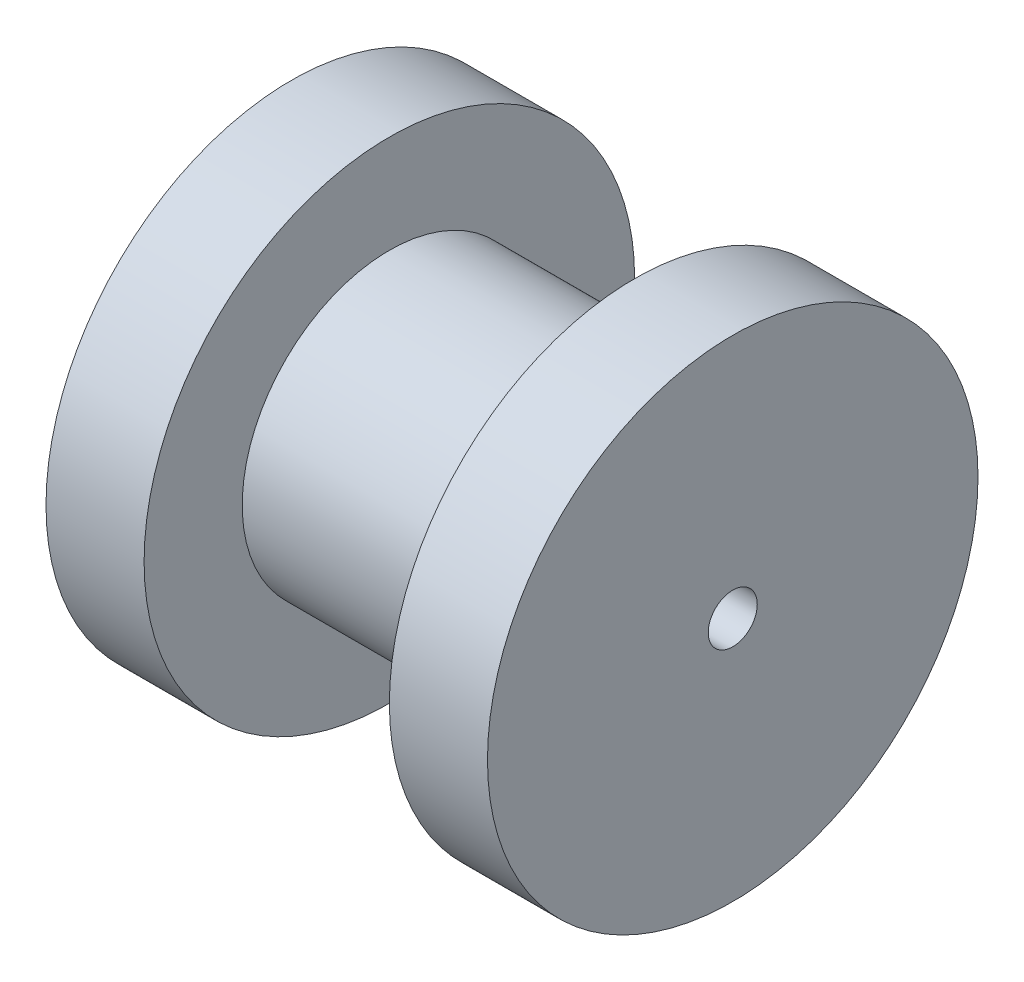
from build123d import *

# Parameters (mm, degrees)
SKETCH1_R           = 5
BOSS_EXTRUDE1_DEPTH = 2
SKETCH2_R           = 3
BOSS_EXTRUDE2_DEPTH = 5
SKETCH5_R           = 5
BOSS_EXTRUDE4_DEPTH = 2
CUT_EXTRUDE1_DEPTH  = 1
SKETCH7_R           = 0.5
CUT_EXTRUDE2_DEPTH  = 12.445523142


with BuildPart() as part:
    # Sketch1 → Boss-Extrude1 (new body)
    with BuildSketch(Plane(origin=(0, 0, 0), x_dir=(0, 0, -1), z_dir=(1, 0, 0))):
        Circle(SKETCH1_R)
    extrude(amount=BOSS_EXTRUDE1_DEPTH)

    # Sketch2 → Boss-Extrude2 (add)
    with BuildSketch(Plane(origin=(2, 0, 0), x_dir=(0, 0, -1), z_dir=(1, 0, 0))):
        Circle(SKETCH2_R)
    extrude(amount=BOSS_EXTRUDE2_DEPTH)

    # Sketch5 → Boss-Extrude4 (add)
    with BuildSketch(Plane(origin=(7, 0, 0), x_dir=(0, 0, -1), z_dir=(1, 0, 0))):
        Circle(SKETCH5_R)
    extrude(amount=BOSS_EXTRUDE4_DEPTH)

    # Sketch6 → Cut-Extrude1 (cut)
    with BuildSketch(Plane.ZY):
        with BuildLine():
            Line((0.095962652, 2.197906087), (0.109048468, 2.497620554))
            ThreePointArc((0.109048468, 2.497620554), (0.217889357, 2.490486745), (0.326315481, 2.478612153))
            Line((0.326315481, 2.478612153), (0.287157623, 2.181178695))
            ThreePointArc((0.287157623, 2.181178695), (0.382025991, 2.166577057), (0.476167151, 2.147851216))
            Line((0.476167151, 2.147851216), (0.541099035, 2.440740018))
            ThreePointArc((0.541099035, 2.440740018), (0.647047613, 2.414814566), (0.751764499, 2.384292377))
            Line((0.751764499, 2.384292377), (0.661552759, 2.098177292))
            ThreePointArc((0.661552759, 2.098177292), (0.752444315, 2.067323766), (0.841903551, 2.032534972))
            Line((0.841903551, 2.032534972), (0.956708581, 2.309698831))
            ThreePointArc((0.956708581, 2.309698831), (1.056545654, 2.265769468), (1.154371533, 2.217527083))
            Line((1.154371533, 2.217527083), (1.015846949, 1.951423833))
            ThreePointArc((1.015846949, 1.951423833), (1.1, 1.905255888), (1.182059138, 1.855461181))
            Line((1.182059138, 1.855461181), (1.343249021, 2.108478615))
            ThreePointArc((1.343249021, 2.108478615), (1.433941091, 2.047880111), (1.521903573, 1.983383351))
            Line((1.521903573, 1.983383351), (1.339275144, 1.745377349))
            ThreePointArc((1.339275144, 1.745377349), (1.414132741, 1.685297775), (1.486298457, 1.622010141))
            Line((1.486298457, 1.622010141), (1.688975519, 1.843193342))
            ThreePointArc((1.688975519, 1.843193342), (1.767766953, 1.767766953), (1.843193342, 1.688975519))
            Line((1.843193342, 1.688975519), (1.622010141, 1.486298457))
            ThreePointArc((1.622010141, 1.486298457), (1.685297775, 1.414132741), (1.745377349, 1.339275144))
            Line((1.745377349, 1.339275144), (1.983383351, 1.521903573))
            ThreePointArc((1.983383351, 1.521903573), (2.047880111, 1.433941091), (2.108478615, 1.343249021))
            Line((2.108478615, 1.343249021), (1.855461181, 1.182059138))
            ThreePointArc((1.855461181, 1.182059138), (1.905255888, 1.1), (1.951423833, 1.015846949))
            Line((1.951423833, 1.015846949), (2.217527083, 1.154371533))
            ThreePointArc((2.217527083, 1.154371533), (2.265769468, 1.056545654), (2.309698831, 0.956708581))
            Line((2.309698831, 0.956708581), (2.032534972, 0.841903551))
            ThreePointArc((2.032534972, 0.841903551), (2.067323766, 0.752444315), (2.098177292, 0.661552759))
            Line((2.098177292, 0.661552759), (2.384292377, 0.751764499))
            ThreePointArc((2.384292377, 0.751764499), (2.414814566, 0.647047613), (2.440740018, 0.541099035))
            Line((2.440740018, 0.541099035), (2.147851216, 0.476167151))
            ThreePointArc((2.147851216, 0.476167151), (2.166577057, 0.382025991), (2.181178695, 0.287157623))
            Line((2.181178695, 0.287157623), (2.478612153, 0.326315481))
            ThreePointArc((2.478612153, 0.326315481), (2.490486745, 0.217889357), (2.497620554, 0.109048468))
            Line((2.497620554, 0.109048468), (2.197906087, 0.095962652))
            ThreePointArc((2.197906087, 0.095962652), (2.2, 0), (2.197906087, -0.095962652))
            Line((2.197906087, -0.095962652), (2.497620554, -0.109048468))
            ThreePointArc((2.497620554, -0.109048468), (2.490486745, -0.217889357), (2.478612153, -0.326315481))
            Line((2.478612153, -0.326315481), (2.181178695, -0.287157623))
            ThreePointArc((2.181178695, -0.287157623), (2.166577057, -0.382025991), (2.147851216, -0.476167151))
            Line((2.147851216, -0.476167151), (2.440740018, -0.541099035))
            ThreePointArc((2.440740018, -0.541099035), (2.414814566, -0.647047613), (2.384292377, -0.751764499))
            Line((2.384292377, -0.751764499), (2.098177292, -0.661552759))
            ThreePointArc((2.098177292, -0.661552759), (2.067323766, -0.752444315), (2.032534972, -0.841903551))
            Line((2.032534972, -0.841903551), (2.309698831, -0.956708581))
            ThreePointArc((2.309698831, -0.956708581), (2.265769468, -1.056545654), (2.217527083, -1.154371533))
            Line((2.217527083, -1.154371533), (1.951423833, -1.015846949))
            ThreePointArc((1.951423833, -1.015846949), (1.905255888, -1.1), (1.855461181, -1.182059138))
            Line((1.855461181, -1.182059138), (2.108478615, -1.343249021))
            ThreePointArc((2.108478615, -1.343249021), (2.047880111, -1.433941091), (1.983383351, -1.521903573))
            Line((1.983383351, -1.521903573), (1.745377349, -1.339275144))
            ThreePointArc((1.745377349, -1.339275144), (1.685297775, -1.414132741), (1.622010141, -1.486298457))
            Line((1.622010141, -1.486298457), (1.843193342, -1.688975519))
            ThreePointArc((1.843193342, -1.688975519), (1.767766953, -1.767766953), (1.688975519, -1.843193342))
            Line((1.688975519, -1.843193342), (1.486298457, -1.622010141))
            ThreePointArc((1.486298457, -1.622010141), (1.414132741, -1.685297775), (1.339275144, -1.745377349))
            Line((1.339275144, -1.745377349), (1.521903573, -1.983383351))
            ThreePointArc((1.521903573, -1.983383351), (1.433941091, -2.047880111), (1.343249021, -2.108478615))
            Line((1.343249021, -2.108478615), (1.182059138, -1.855461181))
            ThreePointArc((1.182059138, -1.855461181), (1.1, -1.905255888), (1.015846949, -1.951423833))
            Line((1.015846949, -1.951423833), (1.154371533, -2.217527083))
            ThreePointArc((1.154371533, -2.217527083), (1.056545654, -2.265769468), (0.956708581, -2.309698831))
            Line((0.956708581, -2.309698831), (0.841903551, -2.032534972))
            ThreePointArc((0.841903551, -2.032534972), (0.752444315, -2.067323766), (0.661552759, -2.098177292))
            Line((0.661552759, -2.098177292), (0.751764499, -2.384292377))
            ThreePointArc((0.751764499, -2.384292377), (0.647047613, -2.414814566), (0.541099035, -2.440740018))
            Line((0.541099035, -2.440740018), (0.476167151, -2.147851216))
            ThreePointArc((0.476167151, -2.147851216), (0.382025991, -2.166577057), (0.287157623, -2.181178695))
            Line((0.287157623, -2.181178695), (0.326315481, -2.478612153))
            ThreePointArc((0.326315481, -2.478612153), (0.217889357, -2.490486745), (0.109048468, -2.497620554))
            Line((0.109048468, -2.497620554), (0.095962652, -2.197906087))
            ThreePointArc((0.095962652, -2.197906087), (0, -2.2), (-0.095962652, -2.197906087))
            Line((-0.095962652, -2.197906087), (-0.109048468, -2.497620554))
            ThreePointArc((-0.109048468, -2.497620554), (-0.217889357, -2.490486745), (-0.326315481, -2.478612153))
            Line((-0.326315481, -2.478612153), (-0.287157623, -2.181178695))
            ThreePointArc((-0.287157623, -2.181178695), (-0.382025991, -2.166577057), (-0.476167151, -2.147851216))
            Line((-0.476167151, -2.147851216), (-0.541099035, -2.440740018))
            ThreePointArc((-0.541099035, -2.440740018), (-0.647047613, -2.414814566), (-0.751764499, -2.384292377))
            Line((-0.751764499, -2.384292377), (-0.661552759, -2.098177292))
            ThreePointArc((-0.661552759, -2.098177292), (-0.752444315, -2.067323766), (-0.841903551, -2.032534972))
            Line((-0.841903551, -2.032534972), (-0.956708581, -2.309698831))
            ThreePointArc((-0.956708581, -2.309698831), (-1.056545654, -2.265769468), (-1.154371533, -2.217527083))
            Line((-1.154371533, -2.217527083), (-1.015846949, -1.951423833))
            ThreePointArc((-1.015846949, -1.951423833), (-1.1, -1.905255888), (-1.182059138, -1.855461181))
            Line((-1.182059138, -1.855461181), (-1.343249021, -2.108478615))
            ThreePointArc((-1.343249021, -2.108478615), (-1.433941091, -2.047880111), (-1.521903573, -1.983383351))
            Line((-1.521903573, -1.983383351), (-1.339275144, -1.745377349))
            ThreePointArc((-1.339275144, -1.745377349), (-1.414132741, -1.685297775), (-1.486298457, -1.622010141))
            Line((-1.486298457, -1.622010141), (-1.688975519, -1.843193342))
            ThreePointArc((-1.688975519, -1.843193342), (-1.767766953, -1.767766953), (-1.843193342, -1.688975519))
            Line((-1.843193342, -1.688975519), (-1.622010141, -1.486298457))
            ThreePointArc((-1.622010141, -1.486298457), (-1.685297775, -1.414132741), (-1.745377349, -1.339275144))
            Line((-1.745377349, -1.339275144), (-1.983383351, -1.521903573))
            ThreePointArc((-1.983383351, -1.521903573), (-2.047880111, -1.433941091), (-2.108478615, -1.343249021))
            Line((-2.108478615, -1.343249021), (-1.855461181, -1.182059138))
            ThreePointArc((-1.855461181, -1.182059138), (-1.905255888, -1.1), (-1.951423833, -1.015846949))
            Line((-1.951423833, -1.015846949), (-2.217527083, -1.154371533))
            ThreePointArc((-2.217527083, -1.154371533), (-2.265769468, -1.056545654), (-2.309698831, -0.956708581))
            Line((-2.309698831, -0.956708581), (-2.032534972, -0.841903551))
            ThreePointArc((-2.032534972, -0.841903551), (-2.067323766, -0.752444315), (-2.098177292, -0.661552759))
            Line((-2.098177292, -0.661552759), (-2.384292377, -0.751764499))
            ThreePointArc((-2.384292377, -0.751764499), (-2.414814566, -0.647047613), (-2.440740018, -0.541099035))
            Line((-2.440740018, -0.541099035), (-2.147851216, -0.476167151))
            ThreePointArc((-2.147851216, -0.476167151), (-2.166577057, -0.382025991), (-2.181178695, -0.287157623))
            Line((-2.181178695, -0.287157623), (-2.478612153, -0.326315481))
            ThreePointArc((-2.478612153, -0.326315481), (-2.490486745, -0.217889357), (-2.497620554, -0.109048468))
            Line((-2.497620554, -0.109048468), (-2.197906087, -0.095962652))
            ThreePointArc((-2.197906087, -0.095962652), (-2.2, 0), (-2.197906087, 0.095962652))
            Line((-2.197906087, 0.095962652), (-2.497620554, 0.109048468))
            ThreePointArc((-2.497620554, 0.109048468), (-2.490486745, 0.217889357), (-2.478612153, 0.326315481))
            Line((-2.478612153, 0.326315481), (-2.181178695, 0.287157623))
            ThreePointArc((-2.181178695, 0.287157623), (-2.166577057, 0.382025991), (-2.147851216, 0.476167151))
            Line((-2.147851216, 0.476167151), (-2.440740018, 0.541099035))
            ThreePointArc((-2.440740018, 0.541099035), (-2.414814566, 0.647047613), (-2.384292377, 0.751764499))
            Line((-2.384292377, 0.751764499), (-2.098177292, 0.661552759))
            ThreePointArc((-2.098177292, 0.661552759), (-2.067323766, 0.752444315), (-2.032534972, 0.841903551))
            Line((-2.032534972, 0.841903551), (-2.309698831, 0.956708581))
            ThreePointArc((-2.309698831, 0.956708581), (-2.265769468, 1.056545654), (-2.217527083, 1.154371533))
            Line((-2.217527083, 1.154371533), (-1.951423833, 1.015846949))
            ThreePointArc((-1.951423833, 1.015846949), (-1.905255888, 1.1), (-1.855461181, 1.182059138))
            Line((-1.855461181, 1.182059138), (-2.108478615, 1.343249021))
            ThreePointArc((-2.108478615, 1.343249021), (-2.047880111, 1.433941091), (-1.983383351, 1.521903573))
            Line((-1.983383351, 1.521903573), (-1.745377349, 1.339275144))
            ThreePointArc((-1.745377349, 1.339275144), (-1.685297775, 1.414132741), (-1.622010141, 1.486298457))
            Line((-1.622010141, 1.486298457), (-1.843193342, 1.688975519))
            ThreePointArc((-1.843193342, 1.688975519), (-1.767766953, 1.767766953), (-1.688975519, 1.843193342))
            Line((-1.688975519, 1.843193342), (-1.486298457, 1.622010141))
            ThreePointArc((-1.486298457, 1.622010141), (-1.414132741, 1.685297775), (-1.339275144, 1.745377349))
            Line((-1.339275144, 1.745377349), (-1.521903573, 1.983383351))
            ThreePointArc((-1.521903573, 1.983383351), (-1.433941091, 2.047880111), (-1.343249021, 2.108478615))
            Line((-1.343249021, 2.108478615), (-1.182059138, 1.855461181))
            ThreePointArc((-1.182059138, 1.855461181), (-1.1, 1.905255888), (-1.015846949, 1.951423833))
            Line((-1.015846949, 1.951423833), (-1.154371533, 2.217527083))
            ThreePointArc((-1.154371533, 2.217527083), (-1.056545654, 2.265769468), (-0.956708581, 2.309698831))
            Line((-0.956708581, 2.309698831), (-0.841903551, 2.032534972))
            ThreePointArc((-0.841903551, 2.032534972), (-0.752444315, 2.067323766), (-0.661552759, 2.098177292))
            Line((-0.661552759, 2.098177292), (-0.751764499, 2.384292377))
            ThreePointArc((-0.751764499, 2.384292377), (-0.647047613, 2.414814566), (-0.541099035, 2.440740018))
            Line((-0.541099035, 2.440740018), (-0.476167151, 2.147851216))
            ThreePointArc((-0.476167151, 2.147851216), (-0.382025991, 2.166577057), (-0.287157623, 2.181178695))
            Line((-0.287157623, 2.181178695), (-0.326315481, 2.478612153))
            ThreePointArc((-0.326315481, 2.478612153), (-0.217889357, 2.490486745), (-0.109048468, 2.497620554))
            Line((-0.109048468, 2.497620554), (-0.095962652, 2.197906087))
            ThreePointArc((-0.095962652, 2.197906087), (0, 2.2), (0.095962652, 2.197906087))
        make_face()
    extrude(amount=-CUT_EXTRUDE1_DEPTH, mode=Mode.SUBTRACT)

    # Sketch7 → Cut-Extrude2 (cut, through all)
    with BuildSketch(Plane(origin=(9, 0, 0), x_dir=(0, 0, -1), z_dir=(1, 0, 0))):
        Circle(SKETCH7_R)
    extrude(amount=-CUT_EXTRUDE2_DEPTH, mode=Mode.SUBTRACT)


solid = part.part
